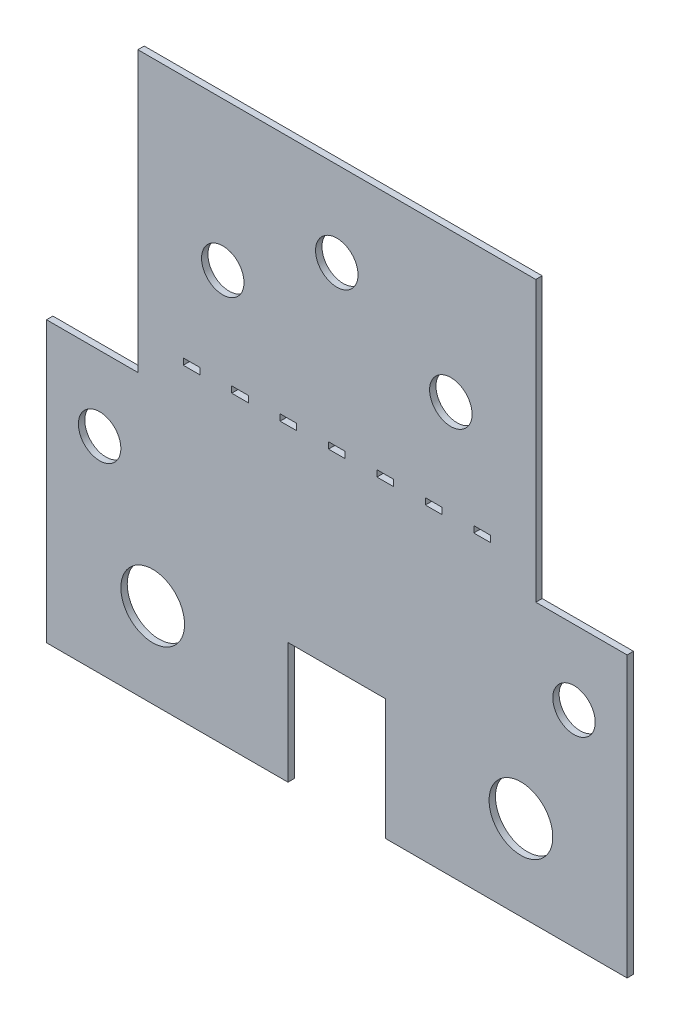
from build123d import *

# Parameters (mm, degrees)
SKETCH1_W               = 273.4
SKETCH1_H               = 263.4
BOSS_EXTRUDE1_DEPTH     = 3
SKETCH2_W               = 43
SKETCH2_H               = 131.64
CUT_EXTRUDE1_DEPTH      = 380.652630703
SKETCH3_W               = 46
SKETCH3_H               = 57
CUT_EXTRUDE2_DEPTH      = 380.652630703
SKETCH5_W               = 7.8
SKETCH5_H               = 3
CUT_EXTRUDE3_DEPTH      = 380.652630703
LPATTERN2_COUNT         = 4
LPATTERN2_PITCH         = 22.8
LPATTERN2_COUNT_DIR2    = 4
LPATTERN2_PITCH_DIR2    = 22.8
CUT_EXTRUDE4_DEPTH      = 380.652630703
CUT_EXTRUDE4_DEPTH_BACK = 380.652630703
SKETCH6_R               = 10
SKETCH6_R_2             = 15
SKETCH8_R               = 10
CUT_EXTRUDE5_DEPTH      = 380.652630703


with BuildPart() as part:
    # Sketch1 → Boss-Extrude1 (new body)
    with BuildSketch(Plane.XY):
        with Locations((136.7, -131.7)):
            Rectangle(SKETCH1_W, SKETCH1_H)
    extrude(amount=BOSS_EXTRUDE1_DEPTH)

    # Sketch2 → Cut-Extrude1 (cut, through all)
    with BuildSketch(Plane.XY.offset(3)):
        with Locations((21.5, -65.82)):
            Rectangle(SKETCH2_W, SKETCH2_H)
        with Locations((251.9, -65.82)):
            Rectangle(SKETCH2_W, SKETCH2_H)
    extrude(amount=-CUT_EXTRUDE1_DEPTH, mode=Mode.SUBTRACT)

    # Sketch3 → Cut-Extrude2 (cut, through all)
    with BuildSketch(Plane(origin=(0, 0, 0), x_dir=(-1, 0, 0), z_dir=(0, 0, -1))):
        with Locations((-136.7, -234.9)):
            Rectangle(SKETCH3_W, SKETCH3_H)
    extrude(amount=-CUT_EXTRUDE2_DEPTH, mode=Mode.SUBTRACT)

    # Sketch5 → Cut-Extrude3 (cut, through all)
    with BuildSketch(Plane(origin=(0, 0, 0), x_dir=(-1, 0, 0), z_dir=(0, 0, -1))):
        with Locations((-136.7, -116.5)):
            Rectangle(SKETCH5_W, SKETCH5_H)
    cut_extrude3 = extrude(amount=-CUT_EXTRUDE3_DEPTH, mode=Mode.SUBTRACT)

    # LPattern2: Cut-Extrude3 4 × 4
    with Locations(*[Vector(1, 0, 0) * (i * LPATTERN2_PITCH) + Vector(-1, 0, 0) * (j * LPATTERN2_PITCH_DIR2) for i in range(LPATTERN2_COUNT) for j in range(LPATTERN2_COUNT_DIR2) if (i, j) != (0, 0)]):
        add(cut_extrude3, mode=Mode.SUBTRACT)

    # Sketch6 → Cut-Extrude4 (cut, two sides: drawn at the far end of the back side and taken through both)
    with BuildSketch(Plane(origin=(0, 0, 0), x_dir=(-1, 0, 0), z_dir=(0, 0, -1)).offset(-CUT_EXTRUDE4_DEPTH_BACK)):
        with Locations((-248.4, -166.64)):
            Circle(SKETCH6_R)
        with Locations((-25, -166.64)):
            Circle(SKETCH6_R)
        with Locations((-223.4, -223.4)):
            Circle(SKETCH6_R_2)
        with Locations((-50, -223.4)):
            Circle(SKETCH6_R_2)
    extrude(amount=CUT_EXTRUDE4_DEPTH + CUT_EXTRUDE4_DEPTH_BACK, mode=Mode.SUBTRACT)

    # Sketch8 → Cut-Extrude5 (cut, through all)
    with BuildSketch(Plane(origin=(0, 0, 0), x_dir=(-1, 0, 0), z_dir=(0, 0, -1))):
        with Locations((-190.4, -70)):
            Circle(SKETCH8_R)
        with Locations((-136.7, -40)):
            Circle(SKETCH8_R)
        with Locations((-83, -70)):
            Circle(SKETCH8_R)
    extrude(amount=-CUT_EXTRUDE5_DEPTH, mode=Mode.SUBTRACT)


solid = part.part
